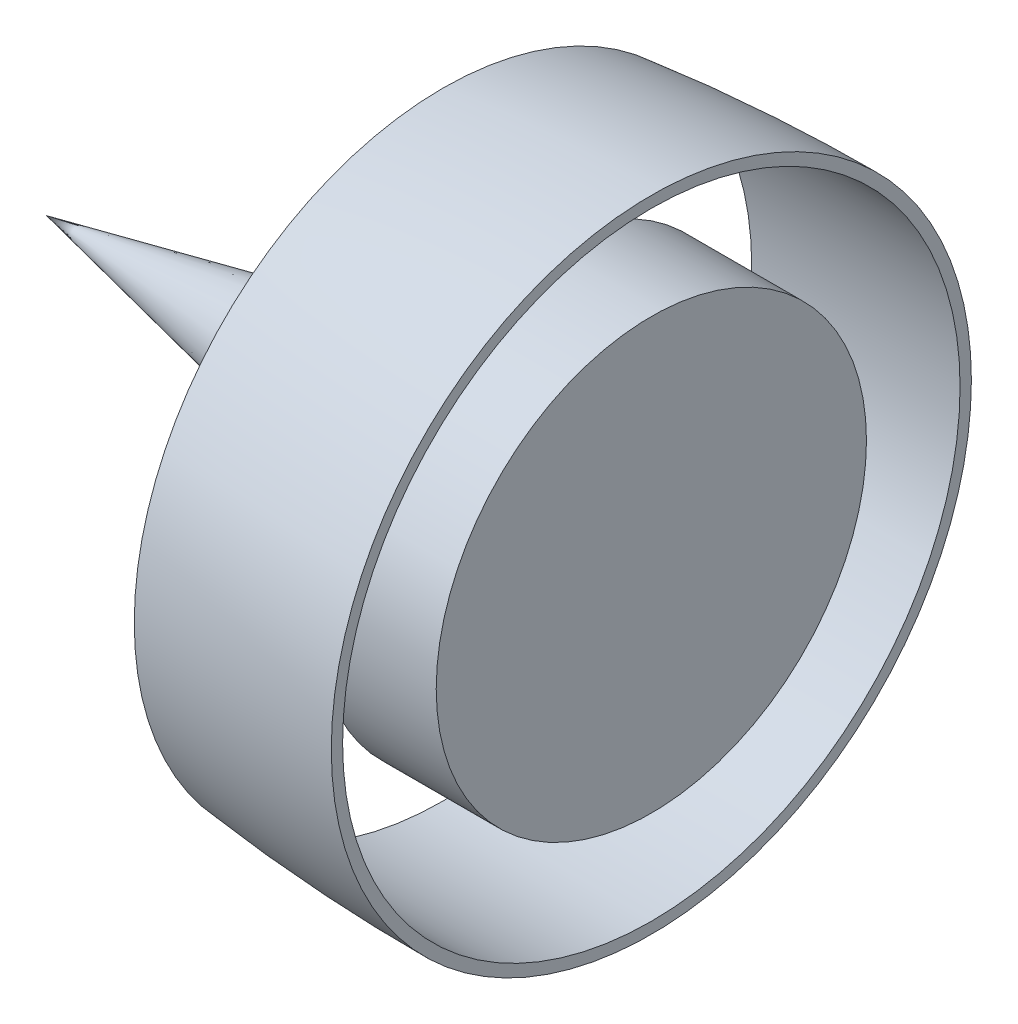
from build123d import *


with BuildPart() as part:
    # Schizzo1 → Rivoluzione1 (revolve)
    with BuildSketch(Plane.XY):
        Polygon((428.23361379, 89.462662963), (0, 0), (1068.743139362, 0), (1068.743139362, 380.199321486), (859.737036943, 380.199321486), (692.998279158, 219.743029603), align=None)
        with BuildLine():
            ThreePointArc((1068.743139362, 565.630651217), (884.369636897, 560.626968634), (700.538911189, 545.630651217))
            Line((700.538911189, 545.630651217), (1068.743139362, 545.630651217))
            Line((1068.743139362, 545.630651217), (1068.743139362, 565.630651217))
        make_face()
    revolve(axis=Axis((-275.018458385, 0, 0), (1, 0, 0)))


solid = part.part
